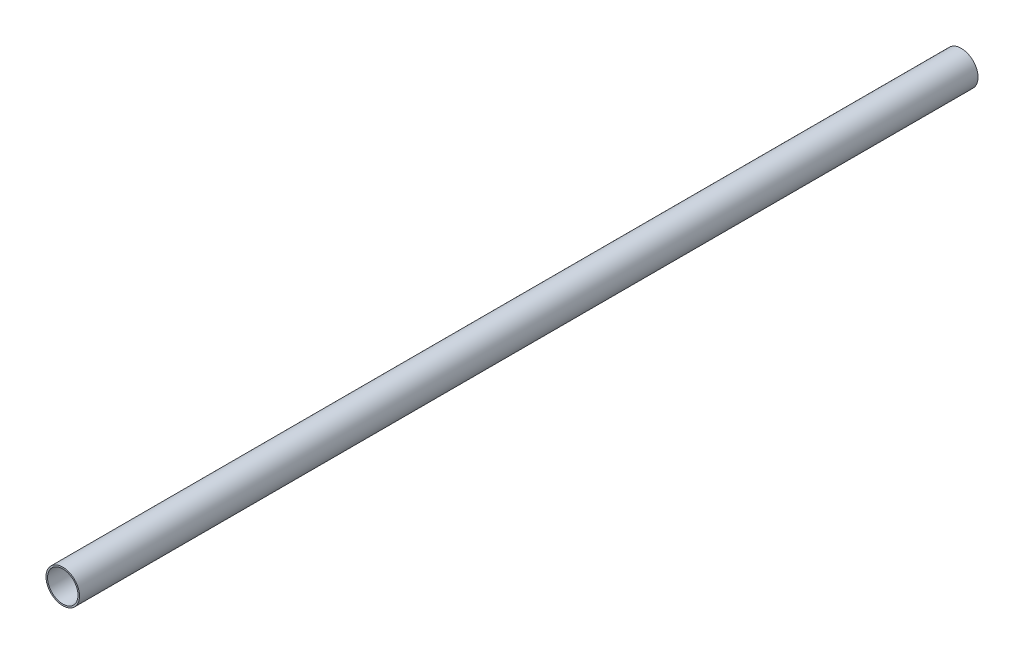
from build123d import *

# Parameters (mm, degrees)
SKETCH1_R           = 27.94
SKETCH1_R_2         = 25.4
BOSS_EXTRUDE1_DEPTH = 1498.6


with BuildPart() as part:
    # Sketch1 → Boss-Extrude1 (new body)
    with BuildSketch(Plane.XY):
        Circle(SKETCH1_R)
        Circle(SKETCH1_R_2, mode=Mode.SUBTRACT)
    extrude(amount=BOSS_EXTRUDE1_DEPTH)


solid = part.part
